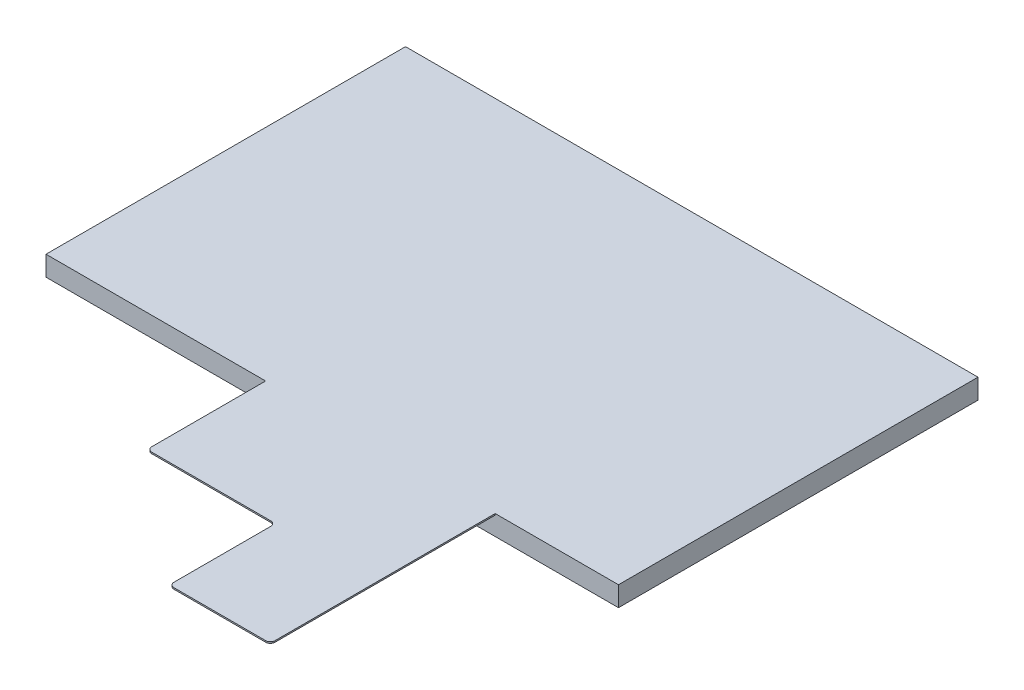
from build123d import *

# Parameters (mm, degrees)
SKETCH1_W           = 120.7
SKETCH1_H           = 75.8
BOSS_EXTRUDE1_DEPTH = 4.2
SKETCH2_W           = 48.4
SKETCH2_H           = 47.4
BOSS_EXTRUDE2_DEPTH = 0.3
SKETCH4_W           = 27.08
SKETCH4_H           = 22.41
CUT_EXTRUDE1_DEPTH  = 0.3
FILLET2_R           = 1


with BuildPart() as part:
    # Sketch1 → Boss-Extrude1 (new body)
    with BuildSketch(Plane(origin=(0, 0, 0), x_dir=(1, 0, 0), z_dir=(0, 1, 0))):
        with Locations((60.35, -37.9)):
            Rectangle(SKETCH1_W, SKETCH1_H)
    extrude(amount=BOSS_EXTRUDE1_DEPTH)

    # Sketch2 → Boss-Extrude2 (add)
    with BuildSketch(Plane(origin=(0, 4.2, 0), x_dir=(1, 0, 0), z_dir=(0, 1, 0))):
        with Locations((70.5, -99.5)):
            Rectangle(SKETCH2_W, SKETCH2_H)
    extrude(amount=-BOSS_EXTRUDE2_DEPTH)

    # Sketch4 → Cut-Extrude1 (cut)
    with BuildSketch(Plane.XZ.offset(-3.9)):
        with Locations((59.84, 111.995)):
            Rectangle(SKETCH4_W, SKETCH4_H)
    extrude(amount=-CUT_EXTRUDE1_DEPTH, mode=Mode.SUBTRACT)

    # Fillet2
    fillet2_edges = [part.edges().sort_by_distance(p)[0] for p in [
        (46.3, 4.05, 100.79),
        (73.38, 4.05, 100.79),
        (73.38, 4.05, 123.2),
        (94.7, 4.05, 123.2),
    ]]
    fillet(fillet2_edges, radius=FILLET2_R)


solid = part.part
